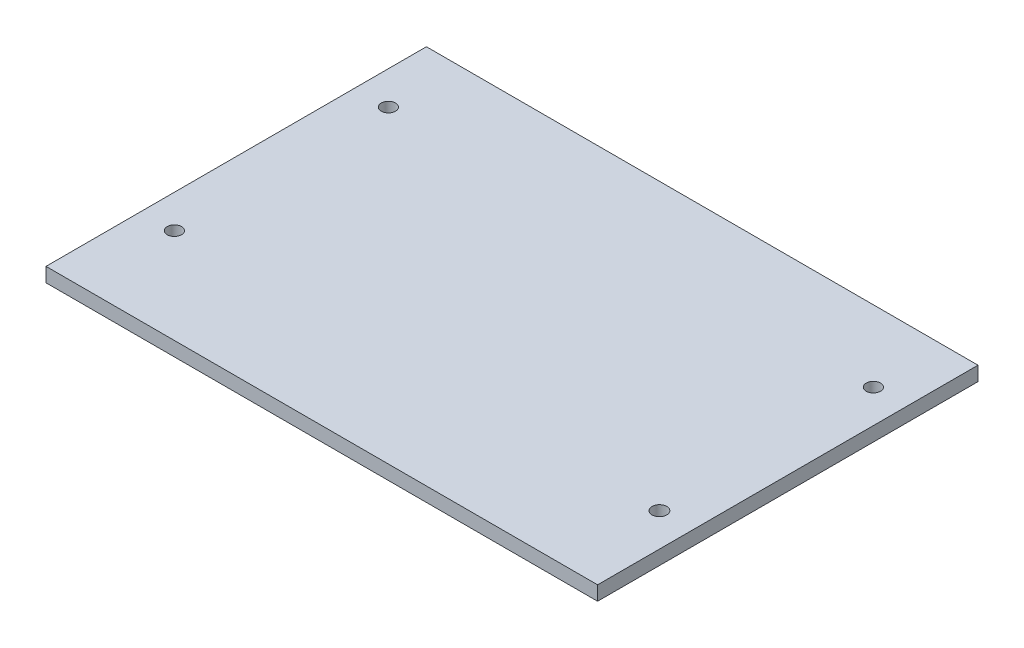
from build123d import *

# Parameters (mm, degrees)
SKETCH_1_W          = 116
SKETCH_1_H          = 80
EXTRUDE_1_DEPTH     = 3
SKETCH_2_R          = 1.5
SKETCH_2_R_2        = 1.55
CUT_EXTRUDE_1_DEPTH = 10


with BuildPart() as part:
    # 草图1 → 凸台-拉伸1 (new body)
    with BuildSketch(Plane(origin=(0, 0, 0), x_dir=(1, 0, 0), z_dir=(0, 1, 0))):
        Rectangle(SKETCH_1_W, SKETCH_1_H)
    extrude(amount=EXTRUDE_1_DEPTH)

    # 草图2 → 切除-拉伸1 (cut)
    with BuildSketch(Plane.XZ):
        with Locations((-51, 20)):
            Circle(SKETCH_2_R)
        with Locations((51, 20)):
            Circle(SKETCH_2_R_2)
        with Locations((51, -25)):
            Circle(SKETCH_2_R)
        with Locations((-51, -25)):
            Circle(SKETCH_2_R)
    extrude(amount=-CUT_EXTRUDE_1_DEPTH, mode=Mode.SUBTRACT)


solid = part.part
